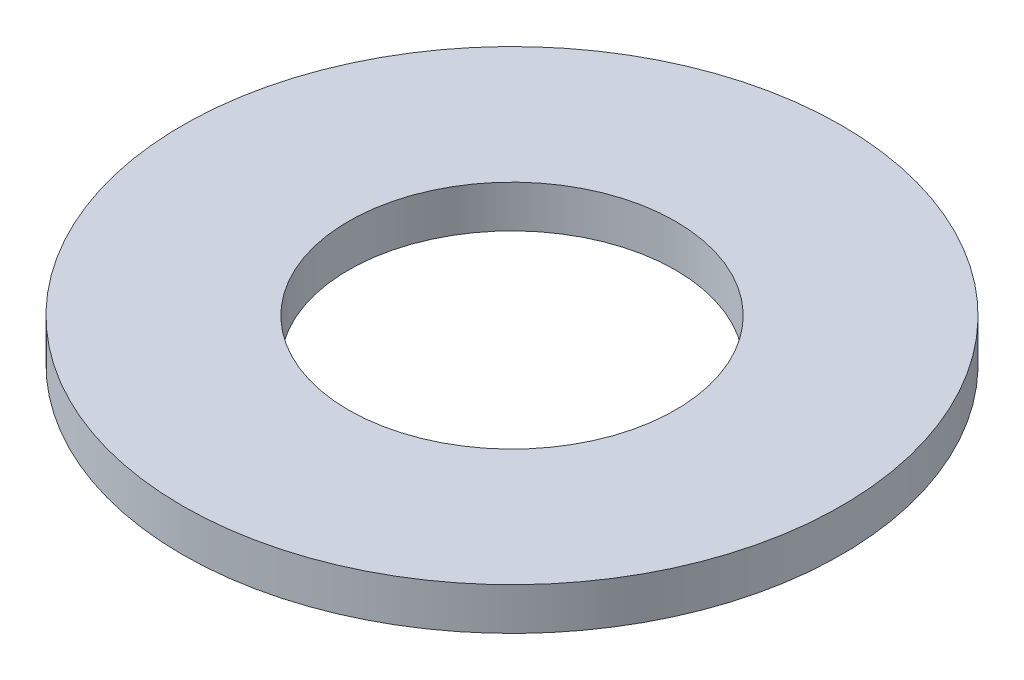
from build123d import *

# Parameters (mm, degrees)
SKETCH1_R           = 6.4
SKETCH1_R_2         = 3.175
BOSS_EXTRUDE1_DEPTH = 0.82


with BuildPart() as part:
    # Sketch1 → Boss-Extrude1 (new body)
    with BuildSketch(Plane(origin=(0, 0, 0), x_dir=(1, 0, 0), z_dir=(0, 1, 0))):
        Circle(SKETCH1_R)
        Circle(SKETCH1_R_2, mode=Mode.SUBTRACT)
    extrude(amount=BOSS_EXTRUDE1_DEPTH)


solid = part.part
